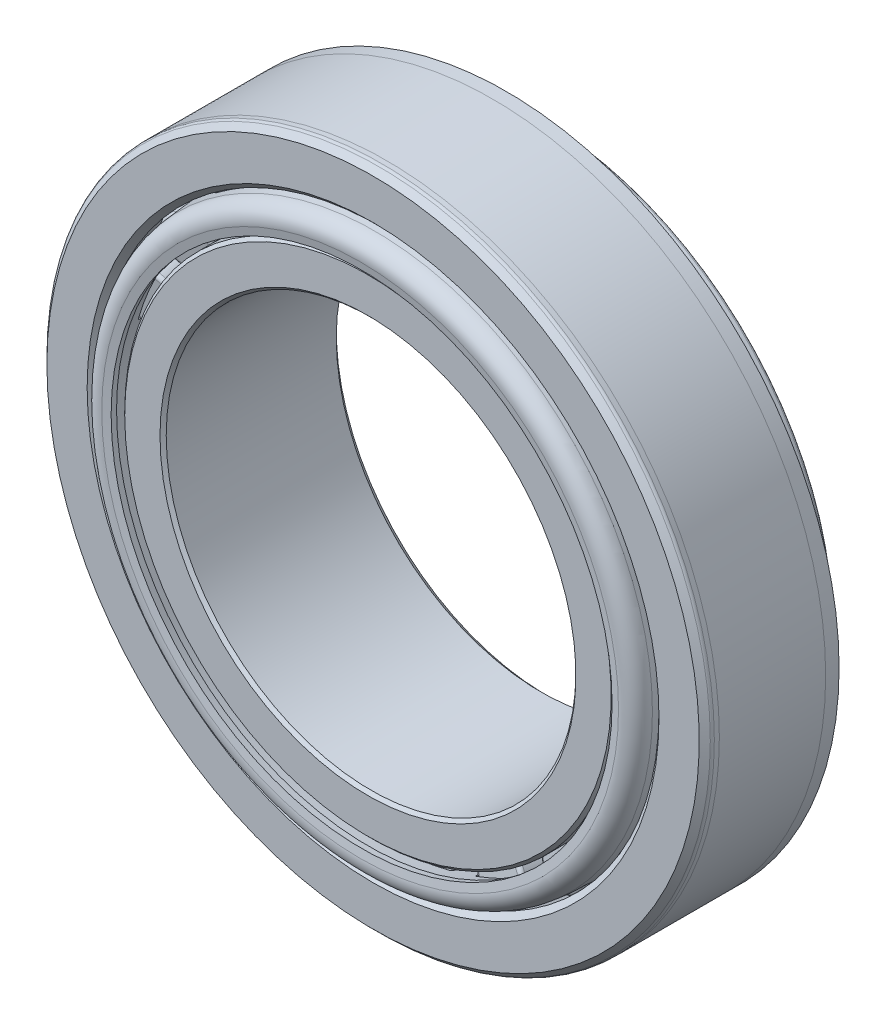
from build123d import *
from OCP.BRepFilletAPI import BRepFilletAPI_MakeChamfer

# Parameters (mm, degrees)
SKETCH8_R                 = 1.675
CUT_EXTRUDE1_DEPTH        = 0.635
FILLET7_R                 = 0.9525
CHAMFER4_SIZE             = 0.41875
CHAMFER4_SIZE2            = 0.411533053
FILLET8_R                 = 0.46425
CIRPATTERN1_COUNT         = 21
FILLET9_R                 = 2.0375
FILLET10_R                = 0.273
FILLET11_R                = 0.3095
CIRPATTERN2_COUNT         = 21
FILLET11_OF_CIRPATTERN2_R = 0.3095
CHAMFER1_SIZE             = 0.831875
CHAMFER1_SIZE2            = 0.705374451
FILLET6_R                 = 0.499125
CHAMFER2_SIZE             = 0.385875
CHAMFER3_SIZE             = 0.7545


with BuildPart() as part:
    # Sketch2 → Revolve1 (revolve)
    with BuildSketch(Plane(origin=(0, 0, 0), x_dir=(0, 0, -1), z_dir=(1, 0, 0)), mode=Mode.PRIVATE) as revolve1_sk:
        Polygon((-8.255, 41.275), (-8.255, 34.62), (8.255, 37.98), (8.255, 41.275), align=None)
    revolve(revolve1_sk.sketch.rotate(Axis((0, 0, 0), (0, 0, -1)), 90), axis=Axis((0, 0, 0), (0, 0, -1)))

    # Chamfer1: one chamfer whose edges measure the first distance from different faces: ONE call of the kernel's chamfer builder (chamfer() names one face for all edges)
    chamfer1_edges_1 = [part.edges().sort_by_distance(p)[0] for p in [
        (-34.62, 0, 8.255),
    ]]
    chamfer1_side_1 = [part.faces().sort_by_distance(p)[0] for p in [
        (-40.107566704, 0, 8.255),
    ]]
    chamfer1_edges_2 = [part.edges().sort_by_distance(p)[0] for p in [
        (-41.275, 0, 8.255),
    ]]
    chamfer1 = BRepFilletAPI_MakeChamfer(part.part.solid().wrapped)
    for e in chamfer1_edges_1:
        chamfer1.Add(CHAMFER1_SIZE, CHAMFER1_SIZE2, e.wrapped, chamfer1_side_1[0].wrapped)  # the first distance lies on this face
    for e in chamfer1_edges_2:
        chamfer1.Add(CHAMFER1_SIZE, e.wrapped)
    add(Compound.cast(chamfer1.Shape()), mode=Mode.REPLACE)

    # Fillet6
    fillet6_edges = [part.edges().sort_by_distance(p)[0] for p in [
        (-41.275, 0, 7.423125),
    ]]
    fillet(fillet6_edges, radius=FILLET6_R)


with BuildPart() as body_2:
    # Sketch3 → Revolve2 (revolve)
    with BuildSketch(Plane(origin=(0, 0, 0), x_dir=(0, 0, -1), z_dir=(1, 0, 0)), mode=Mode.PRIVATE) as revolve2_sk:
        Polygon((-8.89, 30.545), (-8.89, 25.4), (13.335, 25.4), (13.335, 32.945), (7.948634073, 32.945), (8.281154194, 31.149051887), (-5.934452564, 28.776363644), (-6.261915909, 30.545), align=None)
    revolve(revolve2_sk.sketch.rotate(Axis((0, 0, 0), (0, 0, -1)), 90), axis=Axis((0, 0, 0), (0, 0, -1)))

    # Chamfer2
    chamfer2_edges = [body_2.edges().sort_by_distance(p)[0] for p in [
        (-25.4, 0, 8.89),
        (-30.545, 0, 8.89),
    ]]
    chamfer(chamfer2_edges, length=CHAMFER2_SIZE)

    # Chamfer3
    chamfer3_edges = [body_2.edges().sort_by_distance(p)[0] for p in [
        (-32.945, 0, -13.335),
        (-25.4, 0, -13.335),
    ]]
    chamfer(chamfer3_edges, length=CHAMFER3_SIZE)


with BuildPart() as body_3:
    # Sketch4 → Revolve3 (revolve)
    with BuildSketch(Plane(origin=(0, 0, 0), x_dir=(0, 0, -1), z_dir=(1, 0, 0)), mode=Mode.PRIVATE) as revolve3_sk:
        Polygon((12.573, 35.604873045), (12.420072974, 36.430835105), (-10.26228803, 34.221477701), (-9.676609461, 31.058215526), (-8.850647401, 31.211142552), (-8.927110914, 31.624123582), align=None)
    revolve(revolve3_sk.sketch.rotate(Axis((0, 0, 0), (0, 0, -1)), 90), axis=Axis((0, 0, 0), (0, 0, -1)))

    # Fillet9
    fillet9_edges = [body_3.edges().sort_by_distance(p)[0] for p in [
        (-34.221477701, 0, 10.26228803),
    ]]
    fillet(fillet9_edges, radius=FILLET9_R)

    # Fillet10
    fillet10_edges = [body_3.edges().sort_by_distance(p)[0] for p in [
        (-36.430835105, 0, -12.420072974),
        (-35.604873045, 0, -12.573),
    ]]
    fillet(fillet10_edges, radius=FILLET10_R)

    # Sketch9 → Cut-Revolve2 (revolve, cut)
    with BuildSketch(Plane(origin=(0, 0, 0), x_dir=(0, 0, -1), z_dir=(1, 0, 0)), mode=Mode.PRIVATE) as cut_revolve2_sk:
        Polygon((-6.497915834, 31.81964052), (7.671266649, 34.443067245), (8.323420555, 30.920770386), (-5.892186203, 28.548082144), align=None)
    cut_revolve2 = revolve(cut_revolve2_sk.sketch.rotate(Axis((0, 31.81964052, 6.497915834), (0, 0.18205598368333653, -0.983288166716702)), 180), axis=Axis((0, 31.81964052, 6.497915834), (0, 0.18205598368333653, -0.983288166716702)), mode=Mode.SUBTRACT)

    # Fillet11
    fillet11_edges = [body_3.edges().sort_by_distance(p)[0] for p in [
        (-2.938089668, 33.354840151, 6.782158326),
        (2.938089668, 33.354840151, 6.782158326),
        (3.50653129, 35.163031748, -7.537965089),
        (-3.50653129, 35.163031748, -7.537965089),
    ]]
    fillet(fillet11_edges, radius=FILLET11_R)

    # CirPattern2: Cut-Revolve2 ×21 about axis
    cirpattern2_axis = Axis((0, 0, 0), (0, 0, 1))
    for i in range(1, CIRPATTERN2_COUNT):
        add(cut_revolve2.rotate(cirpattern2_axis, i * 360 / CIRPATTERN2_COUNT), mode=Mode.SUBTRACT)

    # Fillet11 of CirPattern2
    fillet11_of_cirpattern2_edges = [body_3.edges().sort_by_distance(p)[0] for p in [
        (-12.639070314, 31.006961058, 6.782158326),
        (-7.023953139, 32.738995322, 6.782158326),
        (-7.013739612, 34.634405149, -7.537965089),
        (-13.715231499, 32.567268665, -7.537965089),
        (-21.217014097, 25.903977402, 6.782158326),
        (-16.361886885, 29.214147086, 6.782158326),
        (-16.91080897, 31.028359662, -7.537965089),
        (-22.705273201, 27.077760842, -7.537965089),
        (-27.909733068, 18.499311677, 6.782158326),
        (-24.245995178, 23.093493677, 6.782158326),
        (-25.30527874, 24.665308254, -7.537965089),
        (-29.677851739, 19.18227514, -7.537965089),
        (-32.122549776, 9.450900926, 6.782158326),
        (-29.975740398, 14.920882011, 6.782158326),
        (-31.451263443, 16.110635966, -7.537965089),
        (-34.01342291, 9.582360111, -7.537965089),
        (-33.481136969, -0.437263847, 6.782158326),
        (-33.042009538, 5.422484499, 6.782158326),
        (-34.802665368, 6.124462971, -7.537965089),
        (-35.326752191, -0.868989664, -7.537965089),
        (-31.864778213, -10.286575808, 6.782158326),
        (-33.172351127, -4.557724557, 6.782158326),
        (-35.061697745, -4.405895435, -7.537965089),
        (-33.50114451, -11.243125895, -7.537965089),
        (-27.417094077, -19.221880366, 6.782158326),
        (-30.355183744, -14.132959785, 6.782158326),
        (-32.205344413, -14.544770697, -7.537965089),
        (-28.698813122, -20.61826105, -7.537965089),
        (-20.533280813, -26.449236501, 6.782158326),
        (-24.840825074, -22.452419515, 6.782158326),
        (-26.487404898, -23.391279254, -7.537965089),
        (-21.346466246, -28.16137323, -7.537965089),
        (-11.824995441, -31.326461901, 6.782158326),
        (-17.119250084, -28.776883239, 6.782158326),
        (-18.41594322, -30.159369998, -7.537965089),
        (-12.097392166, -33.202223813, -7.537965089),
        (-2.066007331, -33.420193688, 6.782158326),
        (-7.876554598, -32.544394603, 6.782158326),
        (-8.70814417, -34.247668366, -7.537965089),
        (-1.773411704, -35.292911105, -7.537965089),
        (7.876554598, -32.544394603, 6.782158326),
        (2.066007331, -33.420193688, 6.782158326),
        (1.773411704, -35.292911105, -7.537965089),
        (8.70814417, -34.247668366, -7.537965089),
        (17.119250084, -28.776883239, 6.782158326),
        (11.824995441, -31.326461901, 6.782158326),
        (12.097392166, -33.202223813, -7.537965089),
        (18.41594322, -30.159369998, -7.537965089),
        (24.840825074, -22.452419515, 6.782158326),
        (20.533280813, -26.449236501, 6.782158326),
        (21.346466246, -28.16137323, -7.537965089),
        (26.487404898, -23.391279254, -7.537965089),
        (30.355183744, -14.132959785, 6.782158326),
        (27.417094077, -19.221880366, 6.782158326),
        (28.698813122, -20.61826105, -7.537965089),
        (32.205344413, -14.544770697, -7.537965089),
        (33.172351127, -4.557724557, 6.782158326),
        (31.864778213, -10.286575808, 6.782158326),
        (33.50114451, -11.243125895, -7.537965089),
        (35.061697745, -4.405895435, -7.537965089),
        (33.042009538, 5.422484499, 6.782158326),
        (33.481136969, -0.437263847, 6.782158326),
        (35.326752191, -0.868989664, -7.537965089),
        (34.802665368, 6.124462971, -7.537965089),
        (29.975740398, 14.920882011, 6.782158326),
        (32.122549776, 9.450900926, 6.782158326),
        (34.01342291, 9.582360111, -7.537965089),
        (31.451263443, 16.110635966, -7.537965089),
        (24.245995178, 23.093493677, 6.782158326),
        (27.909733068, 18.499311677, 6.782158326),
        (29.677851739, 19.18227514, -7.537965089),
        (25.30527874, 24.665308254, -7.537965089),
        (16.361886885, 29.214147086, 6.782158326),
        (21.217014097, 25.903977402, 6.782158326),
        (22.705273201, 27.077760842, -7.537965089),
        (16.91080897, 31.028359662, -7.537965089),
        (7.023953139, 32.738995322, 6.782158326),
        (12.639070314, 31.006961058, 6.782158326),
        (13.715231499, 32.567268665, -7.537965089),
        (7.013739612, 34.634405149, -7.537965089),
    ]]
    fillet(fillet11_of_cirpattern2_edges, radius=FILLET11_OF_CIRPATTERN2_R)


with BuildPart() as body_4:
    # Sketch6 → Revolve4 (revolve)
    with BuildSketch(Plane(origin=(0, 0, 0), x_dir=(0, 0, -1), z_dir=(1, 0, 0))):
        Polygon((8.281154194, 31.149051887), (7.671266649, 34.443067245), (-6.497915834, 31.81964052), (-5.934452564, 28.776363644), align=None)
    revolve(axis=Axis((0, 31.81964052, 6.497915834), (0, 0.18205598368333648, -0.983288166716702)))

    # Sketch8 → Cut-Extrude1 (cut)
    with BuildSketch(Plane(origin=(0, 2.5148544, -13.582781089), x_dir=(-1, 0, 0), z_dir=(0, 0.18205598368333645, -0.983288166716702))):
        with Locations(Location((0, 32.470860452, 0), (0, 0, 90))):
            Circle(SKETCH8_R)
    extrude(amount=-CUT_EXTRUDE1_DEPTH, mode=Mode.SUBTRACT)

    # Fillet7
    # the kernel refuses this fillet: 0.9525 mm, written as the material it adds along each edge
    with BuildSketch(Plane(origin=(0, 34.327461696, -7.046878663), x_dir=(0, 0.983288166716702, 0.18205598368333614), z_dir=(-1, 0, 0))) as fillet7_piece_1:
        with BuildLine():
            CenterArc((0.776974388, 0.9525), FILLET7_R, 270, 70.528779366)
            Line((0.776974388, 0), (0.776974388, -0.01905))
            Line((0.776974388, -0.01905), (1.675, -0.01905))
            Line((1.675, -0.01905), (1.69405, 0))
            ThreePointArc((1.69405, 0), (1.69405, 0.3175), (1.692960512, 0.62865))
            Line((1.692960512, 0.62865), (1.675, 0.635))
        make_face()
    revolve(axis=Axis((0, 34.327461696, -7.046878663), (0, 0.18205598368333645, -0.983288166716702)))

    # Chamfer4
    chamfer4_edges = [body_4.edges().sort_by_distance(p)[0] for p in [
        (0, 37.737082604, -7.061379103),
    ]]
    chamfer4_side = [body_4.faces().sort_by_distance(p)[0] for p in [
        (0, 37.64391378, -7.078629328),
    ]]
    chamfer(chamfer4_edges, length=CHAMFER4_SIZE, length2=CHAMFER4_SIZE2, reference=chamfer4_side[0])

    # Fillet8
    fillet8_edges = [body_4.edges().sort_by_distance(p)[0] for p in [
        (0, 34.862917396, 7.061379103),
    ]]
    fillet(fillet8_edges, radius=FILLET8_R)


with BuildPart() as cirpattern1_1:
    # CirPattern1: pattern copy
    add(body_4.part.rotate(Axis((0, 0, 0), (0, 0, 1)), 1 * 360 / CIRPATTERN1_COUNT))


with BuildPart() as cirpattern1_2:
    # CirPattern1: pattern copy
    add(body_4.part.rotate(Axis((0, 0, 0), (0, 0, 1)), 2 * 360 / CIRPATTERN1_COUNT))


with BuildPart() as cirpattern1_3:
    # CirPattern1: pattern copy
    add(body_4.part.rotate(Axis((0, 0, 0), (0, 0, 1)), 3 * 360 / CIRPATTERN1_COUNT))


with BuildPart() as cirpattern1_4:
    # CirPattern1: pattern copy
    add(body_4.part.rotate(Axis((0, 0, 0), (0, 0, 1)), 4 * 360 / CIRPATTERN1_COUNT))


with BuildPart() as cirpattern1_5:
    # CirPattern1: pattern copy
    add(body_4.part.rotate(Axis((0, 0, 0), (0, 0, 1)), 5 * 360 / CIRPATTERN1_COUNT))


with BuildPart() as cirpattern1_6:
    # CirPattern1: pattern copy
    add(body_4.part.rotate(Axis((0, 0, 0), (0, 0, 1)), 6 * 360 / CIRPATTERN1_COUNT))


with BuildPart() as cirpattern1_7:
    # CirPattern1: pattern copy
    add(body_4.part.rotate(Axis((0, 0, 0), (0, 0, 1)), 7 * 360 / CIRPATTERN1_COUNT))


with BuildPart() as cirpattern1_8:
    # CirPattern1: pattern copy
    add(body_4.part.rotate(Axis((0, 0, 0), (0, 0, 1)), 8 * 360 / CIRPATTERN1_COUNT))


with BuildPart() as cirpattern1_9:
    # CirPattern1: pattern copy
    add(body_4.part.rotate(Axis((0, 0, 0), (0, 0, 1)), 9 * 360 / CIRPATTERN1_COUNT))


with BuildPart() as cirpattern1_10:
    # CirPattern1: pattern copy
    add(body_4.part.rotate(Axis((0, 0, 0), (0, 0, 1)), 10 * 360 / CIRPATTERN1_COUNT))


with BuildPart() as cirpattern1_11:
    # CirPattern1: pattern copy
    add(body_4.part.rotate(Axis((0, 0, 0), (0, 0, 1)), 11 * 360 / CIRPATTERN1_COUNT))


with BuildPart() as cirpattern1_12:
    # CirPattern1: pattern copy
    add(body_4.part.rotate(Axis((0, 0, 0), (0, 0, 1)), 12 * 360 / CIRPATTERN1_COUNT))


with BuildPart() as cirpattern1_13:
    # CirPattern1: pattern copy
    add(body_4.part.rotate(Axis((0, 0, 0), (0, 0, 1)), 13 * 360 / CIRPATTERN1_COUNT))


with BuildPart() as cirpattern1_14:
    # CirPattern1: pattern copy
    add(body_4.part.rotate(Axis((0, 0, 0), (0, 0, 1)), 14 * 360 / CIRPATTERN1_COUNT))


with BuildPart() as cirpattern1_15:
    # CirPattern1: pattern copy
    add(body_4.part.rotate(Axis((0, 0, 0), (0, 0, 1)), 15 * 360 / CIRPATTERN1_COUNT))


with BuildPart() as cirpattern1_16:
    # CirPattern1: pattern copy
    add(body_4.part.rotate(Axis((0, 0, 0), (0, 0, 1)), 16 * 360 / CIRPATTERN1_COUNT))


with BuildPart() as cirpattern1_17:
    # CirPattern1: pattern copy
    add(body_4.part.rotate(Axis((0, 0, 0), (0, 0, 1)), 17 * 360 / CIRPATTERN1_COUNT))


with BuildPart() as cirpattern1_18:
    # CirPattern1: pattern copy
    add(body_4.part.rotate(Axis((0, 0, 0), (0, 0, 1)), 18 * 360 / CIRPATTERN1_COUNT))


with BuildPart() as cirpattern1_19:
    # CirPattern1: pattern copy
    add(body_4.part.rotate(Axis((0, 0, 0), (0, 0, 1)), 19 * 360 / CIRPATTERN1_COUNT))


with BuildPart() as cirpattern1_20:
    # CirPattern1: pattern copy
    add(body_4.part.rotate(Axis((0, 0, 0), (0, 0, 1)), 20 * 360 / CIRPATTERN1_COUNT))


solid = Compound([part.part, body_2.part, body_3.part, body_4.part, cirpattern1_1.part, cirpattern1_2.part, cirpattern1_3.part, cirpattern1_4.part, cirpattern1_5.part, cirpattern1_6.part, cirpattern1_7.part, cirpattern1_8.part, cirpattern1_9.part, cirpattern1_10.part, cirpattern1_11.part, cirpattern1_12.part, cirpattern1_13.part, cirpattern1_14.part, cirpattern1_15.part, cirpattern1_16.part, cirpattern1_17.part, cirpattern1_18.part, cirpattern1_19.part, cirpattern1_20.part])
